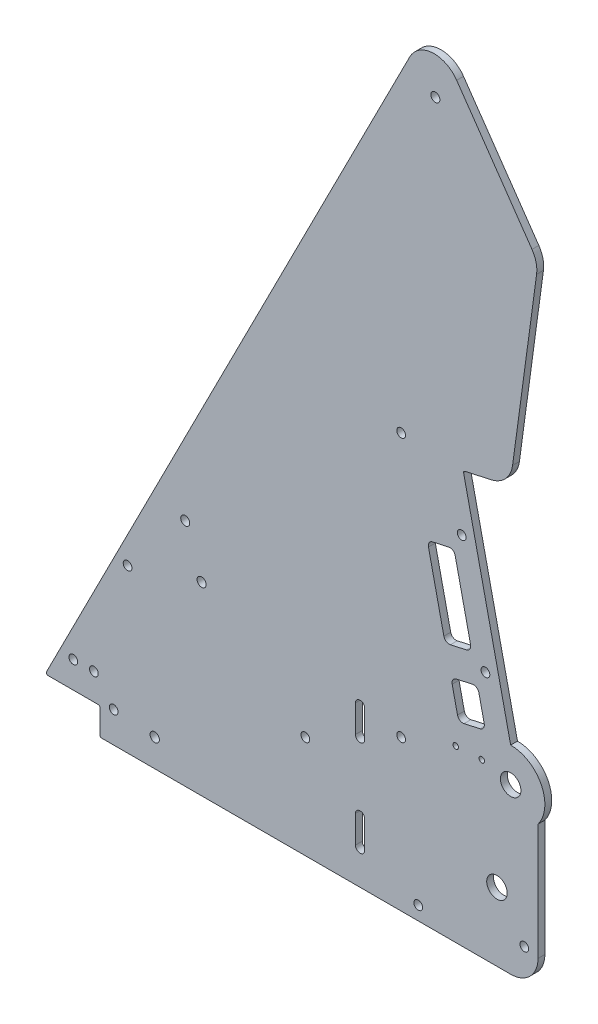
from build123d import *

# Parameters (mm, degrees)
BOSS_EXTRUDE1_DEPTH     = 3.175
SKETCH2_R               = 2.0955
SKETCH2_R_2             = 2.032
SKETCH2_R_3             = 4.7625
CUT_EXTRUDE1_DEPTH      = 421.976111717
SKETCH7_R               = 2.159
CUT_EXTRUDE2_DEPTH      = 421.976111717
CUT_EXTRUDE3_REACH      = 422.976
SKETCH10_R              = 2.032
FILLET1_R               = 12.7
FILLET2_R               = 0.79375
SKETCH12_R              = 2.032
CUT_EXTRUDE5_DEPTH      = 411.989226146
CUT_EXTRUDE6_DEPTH      = 411.989226146
CUT_EXTRUDE6_DEPTH_BACK = 411.989226146
SKETCH13_R              = 1.27
FILLET3_R               = 2.54


with BuildPart() as part:
    # Sketch1 → Boss-Extrude1 (new body)
    with BuildSketch(Plane.XY):
        with BuildLine():
            Line((228.6, -12.7), (228.6, 53.975))
            ThreePointArc((228.6, 53.975), (230.099031657, 70.599515829), (215.9, 79.375))
            Line((215.9, 79.375), (193.909735224, 178.566674323))
            Line((193.909735224, 178.566674323), (215.607913982, 183.377044743))
            Line((215.607913982, 183.377044743), (228.6, 279.4))
            Line((228.6, 279.4), (178.754725958, 351.413083686))
            Line((178.754725958, 351.413083686), (0, 0))
            Line((0, 0), (25.4, 0))
            Line((25.4, 0), (25.4, -12.7))
            Line((25.4, -12.7), (228.6, -12.7))
        make_face()
    extrude(amount=BOSS_EXTRUDE1_DEPTH)

    # Sketch2 → Cut-Extrude1 (cut, through all)
    with BuildSketch(Plane.XY.offset(3.175)):
        with Locations((64.943150167, 94.057839899)):
            Circle(SKETCH2_R)
        with Locations((180.975, 322.164313376)):
            Circle(SKETCH2_R)
        with Locations((72.544547852, 73.173171402)):
            Circle(SKETCH2_R)
        with Locations((193.207821773, 152.394364194)):
            Circle(SKETCH2_R_2)
        with Locations((215.9, 63.5)):
            Circle(SKETCH2_R_3)
        with Locations((173.0375, -6.35)):
            Circle(SKETCH2_R_2)
        with Locations((204.202954161, 102.798527032)):
            Circle(SKETCH2_R_2)
        with Locations((209.55, 19.05)):
            Circle(SKETCH2_R_3)
        with Locations((165.1, 179.3875)):
            Circle(SKETCH2_R_2)
    extrude(amount=-CUT_EXTRUDE1_DEPTH, mode=Mode.SUBTRACT)

    # Sketch7 → Cut-Extrude2 (cut, through all)
    with BuildSketch(Plane.XY.offset(3.175)):
        with Locations((50.8, 0)):
            Circle(SKETCH7_R)
        with BuildLine():
            Line((143.891, 3.175), (143.891, 15.875))
            ThreePointArc((143.891, 15.875), (146.05, 18.034), (148.209, 15.875))
            Line((148.209, 15.875), (148.209, 3.175))
            ThreePointArc((148.209, 3.175), (146.05, 1.016), (143.891, 3.175))
        make_face()
        with BuildLine():
            Line((143.891, 47.625), (143.891, 60.325))
            ThreePointArc((143.891, 60.325), (146.05, 62.484), (148.209, 60.325))
            Line((148.209, 60.325), (148.209, 47.625))
            ThreePointArc((148.209, 47.625), (146.05, 45.466), (143.891, 47.625))
        make_face()
    extrude(amount=-CUT_EXTRUDE2_DEPTH, mode=Mode.SUBTRACT)

    # Sketch10 → Cut-Extrude3 (cut, up to next)
    with BuildSketch(Plane.XY.offset(3.175), mode=Mode.PRIVATE) as cut_extrude3_sk1:
        with Locations((165.1, 57.15)):
            Circle(SKETCH10_R)
    cut_extrude3_tool1 = extrude(cut_extrude3_sk1.sketch, amount=-CUT_EXTRUDE3_REACH, mode=Mode.PRIVATE) & part.part
    # Sketch10 → Cut-Extrude3 (cut, up to next)
    with BuildSketch(Plane.XY.offset(3.175), mode=Mode.PRIVATE) as cut_extrude3_sk2:
        with Locations((120.65, 34.925)):
            Circle(SKETCH10_R)
    cut_extrude3_tool2 = extrude(cut_extrude3_sk2.sketch, amount=-CUT_EXTRUDE3_REACH, mode=Mode.PRIVATE) & part.part
    # Sketch10 → Cut-Extrude3 (cut, up to next)
    with BuildSketch(Plane.XY.offset(3.175), mode=Mode.PRIVATE) as cut_extrude3_sk3:
        with Locations((13.046467246, 12.334704411)):
            Circle(SKETCH10_R)
    cut_extrude3_tool3 = extrude(cut_extrude3_sk3.sketch, amount=-CUT_EXTRUDE3_REACH, mode=Mode.PRIVATE) & part.part
    # Sketch10 → Cut-Extrude3 (cut, up to next)
    with BuildSketch(Plane.XY.offset(3.175), mode=Mode.PRIVATE) as cut_extrude3_sk4:
        with Locations((22.571467246, 12.334704411)):
            Circle(SKETCH10_R)
    cut_extrude3_tool4 = extrude(cut_extrude3_sk4.sketch, amount=-CUT_EXTRUDE3_REACH, mode=Mode.PRIVATE) & part.part
    # Sketch10 → Cut-Extrude3 (cut, up to next)
    with BuildSketch(Plane.XY.offset(3.175), mode=Mode.PRIVATE) as cut_extrude3_sk5:
        with Locations((38.211447917, 62.639810909)):
            Circle(SKETCH10_R)
    cut_extrude3_tool5 = extrude(cut_extrude3_sk5.sketch, amount=-CUT_EXTRUDE3_REACH, mode=Mode.PRIVATE) & part.part
    add(cut_extrude3_tool1.solids().sort_by_distance((165.1, 57.15, 3.175))[0], mode=Mode.SUBTRACT)
    add(cut_extrude3_tool2.solids().sort_by_distance((120.65, 34.925, 3.175))[0], mode=Mode.SUBTRACT)
    add(cut_extrude3_tool3.solids().sort_by_distance((13.046467, 12.334704, 3.175))[0], mode=Mode.SUBTRACT)
    add(cut_extrude3_tool4.solids().sort_by_distance((22.571467, 12.334704, 3.175))[0], mode=Mode.SUBTRACT)
    add(cut_extrude3_tool5.solids().sort_by_distance((38.211448, 62.639811, 3.175))[0], mode=Mode.SUBTRACT)

    # Fillet1
    fillet1_edges = [part.edges().sort_by_distance(p)[0] for p in [
        (228.6, -12.7, 1.5875),
        (178.754725958, 351.413083686, 1.5875),
        (215.607913982, 183.377044743, 1.5875),
        (228.6, 279.4, 1.5875),
    ]]
    fillet(fillet1_edges, radius=FILLET1_R)

    # Fillet2
    fillet2_edges = [part.edges().sort_by_distance(p)[0] for p in [
        (25.4, -12.7, 1.5875),
        (25.4, 0, 1.5875),
        (193.909735224, 178.566674323, 1.5875),
        (0, 0, 1.5875),
    ]]
    fillet(fillet2_edges, radius=FILLET2_R)

    # Sketch12 → Cut-Extrude5 (cut, through all)
    with BuildSketch(Plane.XY.offset(3.175)):
        with Locations((31.75, 1.5875)):
            Circle(SKETCH12_R)
        with Locations((222.25, 1.5875)):
            Circle(SKETCH12_R)
    extrude(amount=-CUT_EXTRUDE5_DEPTH, mode=Mode.SUBTRACT)

    # Sketch13 → Cut-Extrude6 (cut, two sides: drawn at the far end of the back side and taken through both)
    with BuildSketch(Plane.XY.offset(3.175).offset(-CUT_EXTRUDE6_DEPTH_BACK)):
        with Locations((190.426832263, 66.260948917)):
            Circle(SKETCH13_R)
        with Locations((202.533497378, 66.789537331)):
            Circle(SKETCH13_R)
        Polygon((189.622629605, 145.09537131), (197.868978896, 107.898493439), (185.470019606, 105.149710342), (177.223670315, 142.346588213), align=None)
        Polygon((188.218802703, 92.750751051), (200.617761993, 95.499534148), (204.191180019, 79.380887071), (191.792220729, 76.632103974), align=None)
    extrude(amount=CUT_EXTRUDE6_DEPTH + CUT_EXTRUDE6_DEPTH_BACK, mode=Mode.SUBTRACT)

    # Fillet3
    fillet3_edges = [part.edges().sort_by_distance(p)[0] for p in [
        (177.223670315, 142.346588213, 1.5875),
        (189.622629605, 145.09537131, 1.5875),
        (197.868978896, 107.898493439, 1.5875),
        (185.470019606, 105.149710342, 1.5875),
        (200.617761993, 95.499534148, 1.5875),
        (188.218802703, 92.750751051, 1.5875),
        (191.792220729, 76.632103974, 1.5875),
        (204.191180019, 79.380887071, 1.5875),
    ]]
    fillet(fillet3_edges, radius=FILLET3_R)


solid = part.part
